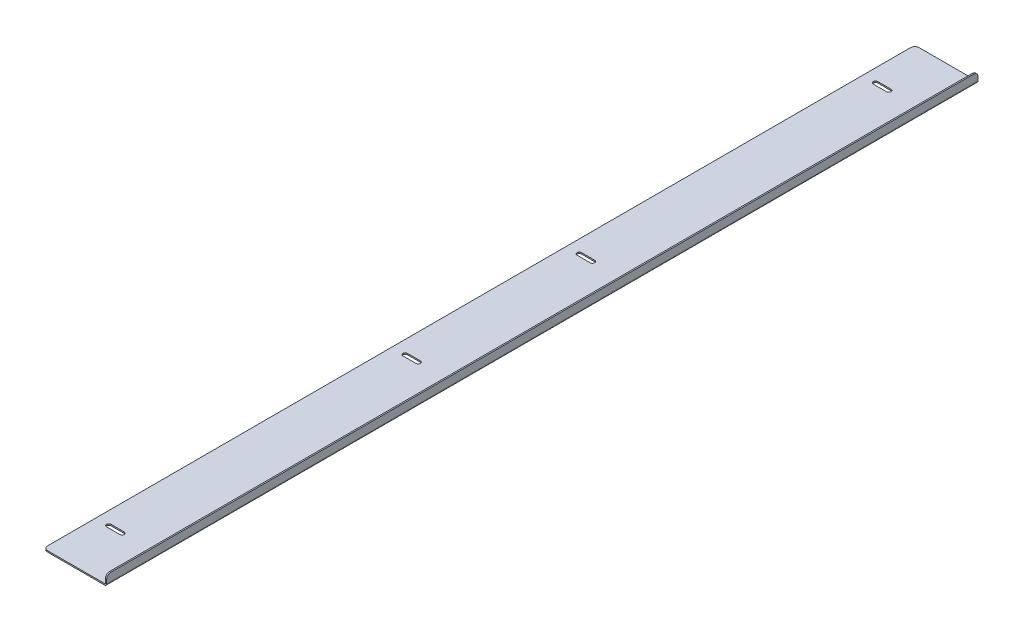
from build123d import *

# Parameters (mm, degrees)
BASE_FLANGE1_DEPTH = 1000
CUT_EXTRUDE2_DEPTH = 1001.734230453
FILLET1_R          = 5


# Sheet-metal steps are written as plain solids
with BuildPart() as part:
    # Sketch1 → Base-Flange1 (new body)
    with BuildSketch(Plane.XY):
        with BuildLine():
            Line((-35.5, -5), (34.7634, -5))
            ThreePointArc((34.7634, -5), (35.284254855, -4.784254855), (35.5, -4.2634))
            Line((35.5, -4.2634), (35.5, 5))
            Line((35.5, 5), (37, 5))
            Line((37, 5), (37, -4.2634))
            ThreePointArc((37, -4.2634), (36.344915027, -5.844915027), (34.7634, -6.5))
            Line((34.7634, -6.5), (-35.5, -6.5))
            Line((-35.5, -6.5), (-35.5, -5))
        make_face()
    extrude(amount=BASE_FLANGE1_DEPTH)

    # Sketch4 → Cut-Extrude2 (cut, through all)
    with BuildSketch(Plane(origin=(0, -5, 0), x_dir=(1, 0, 0), z_dir=(0, 1, 0))):
        with BuildLine():
            ThreePointArc((-20.5, -62.55), (-23.05, -60), (-20.5, -57.45))
            Line((-20.5, -57.45), (-5.5, -57.45))
            ThreePointArc((-5.5, -57.45), (-2.95, -60), (-5.5, -62.55))
            Line((-5.5, -62.55), (-20.5, -62.55))
        make_face()
        with BuildLine():
            ThreePointArc((-20.5, -602.55), (-23.05, -600), (-20.5, -597.45))
            Line((-20.5, -597.45), (-5.5, -597.45))
            ThreePointArc((-5.5, -597.45), (-2.95, -600), (-5.5, -602.55))
            Line((-5.5, -602.55), (-20.5, -602.55))
        make_face()
        with BuildLine():
            ThreePointArc((-5.5, -937.45), (-2.95, -940), (-5.5, -942.55))
            Line((-5.5, -942.55), (-20.5, -942.55))
            ThreePointArc((-20.5, -942.55), (-23.05, -940), (-20.5, -937.45))
            Line((-20.5, -937.45), (-5.5, -937.45))
        make_face()
        with BuildLine():
            ThreePointArc((-5.5, -397.45), (-2.95, -400), (-5.5, -402.55))
            Line((-5.5, -402.55), (-20.5, -402.55))
            ThreePointArc((-20.5, -402.55), (-23.05, -400), (-20.5, -397.45))
            Line((-20.5, -397.45), (-5.5, -397.45))
        make_face()
    extrude(amount=-CUT_EXTRUDE2_DEPTH, mode=Mode.SUBTRACT)

    # Fillet1
    fillet1_edges = [part.edges().sort_by_distance(p)[0] for p in [
        (-35.5, -5.75, 1000),
        (36.25, 5, 1000),
        (-35.5, -5.75, 0),
        (36.25, 5, 0),
    ]]
    fillet(fillet1_edges, radius=FILLET1_R)


solid = part.part
